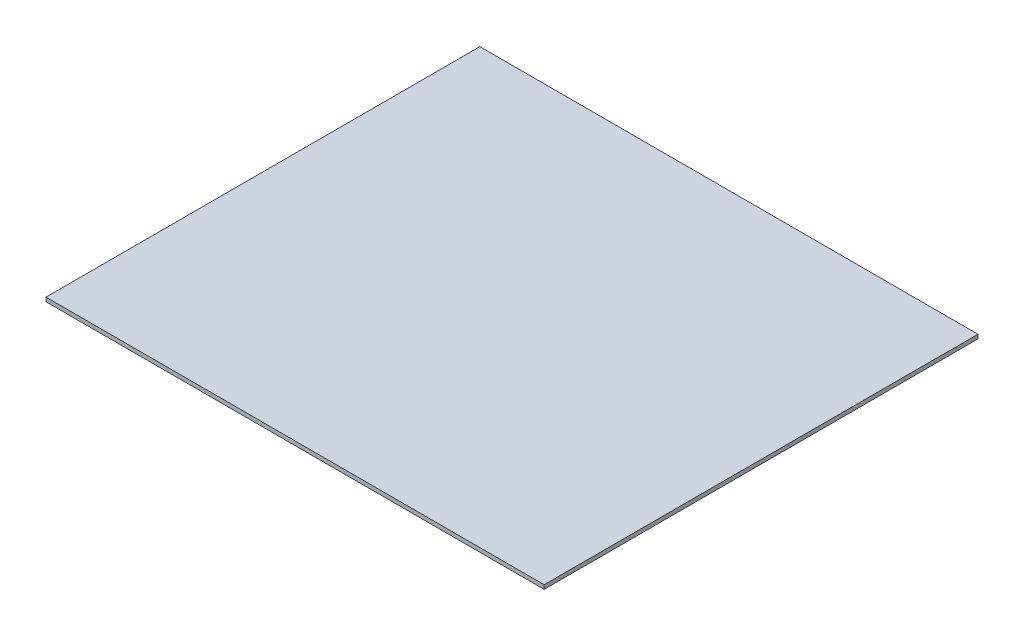
from build123d import *

# Parameters (mm, degrees)
SKETCH1_W           = 393.7
SKETCH1_H           = 342.9
BOSS_EXTRUDE1_DEPTH = 3.175


with BuildPart() as part:
    # Sketch1 → Boss-Extrude1 (new body)
    with BuildSketch(Plane(origin=(0, 0, 0), x_dir=(1, 0, 0), z_dir=(0, 1, 0))):
        Rectangle(SKETCH1_W, SKETCH1_H)
    extrude(amount=BOSS_EXTRUDE1_DEPTH)


solid = part.part
